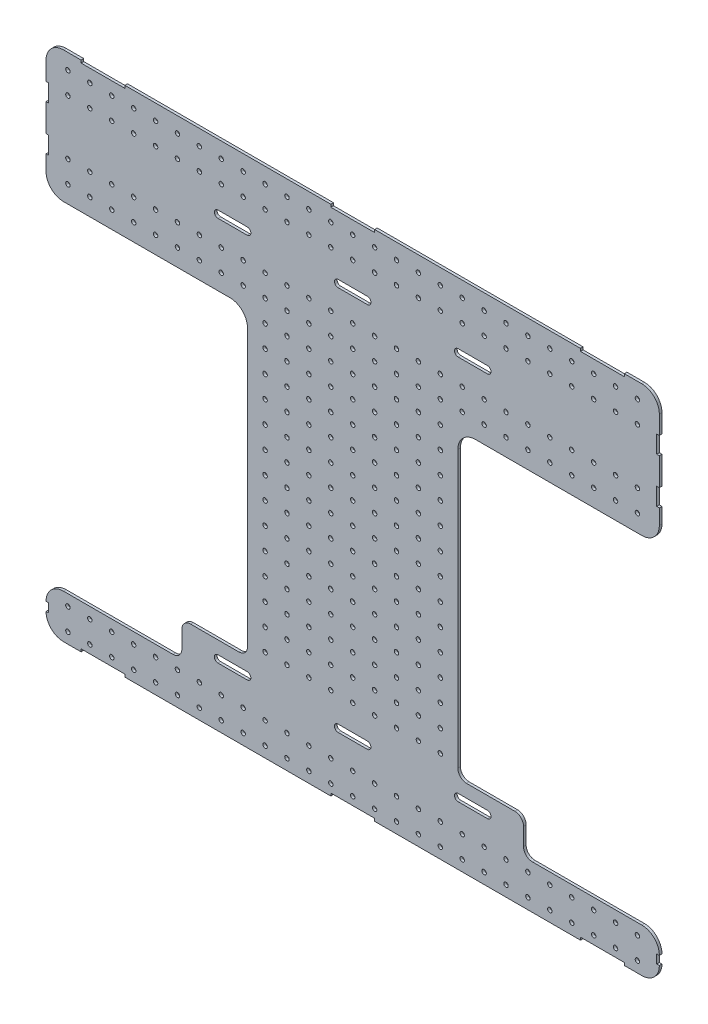
from build123d import *

# Parameters (mm, degrees)
SKETCH1_R           = 2
BOSS_EXTRUDE1_DEPTH = 3
CUT_EXTRUDE1_DEPTH  = 3
SKETCH3_W           = 50
SKETCH3_H           = 3
SKETCH3_W_2         = 3
SKETCH3_H_2         = 20
SKETCH3_H_3         = 10
CUT_EXTRUDE2_DEPTH  = 3
SKETCH4_W           = 235.846701978
SKETCH4_H           = 375.602037454
BOSS_EXTRUDE2_DEPTH = 3
SKETCH9_R           = 2.55
CUT_EXTRUDE7_DEPTH  = 3
SKETCH10_R          = 2.55
CUT_EXTRUDE8_DEPTH  = 3


with BuildPart() as part:
    # Sketch1 → Boss-Extrude1 (new body)
    with BuildSketch(Plane.XY):
        with BuildLine():
            Line((-330, 142.5), (-140, 142.5))
            ThreePointArc((-140, 142.5), (-125.857864376, 136.642135624), (-120, 122.5))
            Line((-120, 122.5), (-120, -192.5))
            ThreePointArc((-120, -192.5), (-122.928932188, -199.571067812), (-130, -202.5))
            Line((-130, -202.5), (-185, -202.5))
            ThreePointArc((-185, -202.5), (-192.071067812, -205.428932188), (-195, -212.5))
            Line((-195, -212.5), (-195, -232.5))
            ThreePointArc((-195, -232.5), (-197.928932188, -239.571067812), (-205, -242.5))
            Line((-205, -242.5), (-330, -242.5))
            ThreePointArc((-330, -242.5), (-344.142135624, -248.357864376), (-350, -262.5))
            Line((-350, -262.5), (-350, -272.5))
            ThreePointArc((-350, -272.5), (-344.142135624, -286.642135624), (-330, -292.5))
            Line((-330, -292.5), (330, -292.5))
            ThreePointArc((330, -292.5), (344.142135624, -286.642135624), (350, -272.5))
            Line((350, -272.5), (350, -262.5))
            ThreePointArc((350, -262.5), (344.142135624, -248.357864376), (330, -242.5))
            Line((330, -242.5), (205, -242.5))
            ThreePointArc((205, -242.5), (197.928932188, -239.571067812), (195, -232.5))
            Line((195, -232.5), (195, -212.5))
            ThreePointArc((195, -212.5), (192.071067812, -205.428932188), (185, -202.5))
            Line((185, -202.5), (130, -202.5))
            ThreePointArc((130, -202.5), (122.928932188, -199.571067812), (120, -192.5))
            Line((120, -192.5), (120, 122.5))
            ThreePointArc((120, 122.5), (125.857864376, 136.642135624), (140, 142.5))
            Line((140, 142.5), (330, 142.5))
            ThreePointArc((330, 142.5), (344.142135624, 148.357864376), (350, 162.5))
            Line((350, 162.5), (350, 272.5))
            ThreePointArc((350, 272.5), (344.142135624, 286.642135624), (330, 292.5))
            Line((330, 292.5), (-330, 292.5))
            ThreePointArc((-330, 292.5), (-344.142135624, 286.642135624), (-350, 272.5))
            Line((-350, 272.5), (-350, 162.5))
            ThreePointArc((-350, 162.5), (-344.142135624, 148.357864376), (-330, 142.5))
        make_face()
        with Locations((-65.041398582, 139.610304632)):
            Circle(SKETCH1_R, mode=Mode.SUBTRACT)
        with Locations((-35.041424734, 139.610304632)):
            Circle(SKETCH1_R, mode=Mode.SUBTRACT)
        with Locations((-5.041450886, 139.610304632)):
            Circle(SKETCH1_R, mode=Mode.SUBTRACT)
        with Locations((24.958522962, 139.610304632)):
            Circle(SKETCH1_R, mode=Mode.SUBTRACT)
        with Locations((54.95849681, 139.610304632)):
            Circle(SKETCH1_R, mode=Mode.SUBTRACT)
        with Locations((84.958470657, 139.610304632)):
            Circle(SKETCH1_R, mode=Mode.SUBTRACT)
        with Locations((114.958444505, 139.610304632)):
            Circle(SKETCH1_R, mode=Mode.SUBTRACT)
        with Locations((-95.082666402, 108.071843093)):
            Circle(SKETCH1_R, mode=Mode.SUBTRACT)
        with Locations((-65.082692554, 108.071843093)):
            Circle(SKETCH1_R, mode=Mode.SUBTRACT)
        with Locations((-35.082718706, 108.071843093)):
            Circle(SKETCH1_R, mode=Mode.SUBTRACT)
        with Locations((-5.082744859, 108.071843093)):
            Circle(SKETCH1_R, mode=Mode.SUBTRACT)
        with Locations((24.917228989, 108.071843093)):
            Circle(SKETCH1_R, mode=Mode.SUBTRACT)
        with Locations((54.917202837, 108.071843093)):
            Circle(SKETCH1_R, mode=Mode.SUBTRACT)
        with Locations((84.917176685, 108.071843093)):
            Circle(SKETCH1_R, mode=Mode.SUBTRACT)
        with Locations((114.917150533, 108.071843093)):
            Circle(SKETCH1_R, mode=Mode.SUBTRACT)
        with Locations((-65.123986527, 76.533381555)):
            Circle(SKETCH1_R, mode=Mode.SUBTRACT)
        with Locations((-35.124012679, 76.533381555)):
            Circle(SKETCH1_R, mode=Mode.SUBTRACT)
        with Locations((-5.124038831, 76.533381555)):
            Circle(SKETCH1_R, mode=Mode.SUBTRACT)
        with Locations((24.875935016, 76.533381555)):
            Circle(SKETCH1_R, mode=Mode.SUBTRACT)
        with Locations((54.875908864, 76.533381555)):
            Circle(SKETCH1_R, mode=Mode.SUBTRACT)
        with Locations((84.875882712, 76.533381555)):
            Circle(SKETCH1_R, mode=Mode.SUBTRACT)
        with Locations((114.87585656, 76.533381555)):
            Circle(SKETCH1_R, mode=Mode.SUBTRACT)
        with Locations((-95.165254347, 44.994920016)):
            Circle(SKETCH1_R, mode=Mode.SUBTRACT)
        with Locations((-65.1652805, 44.994920016)):
            Circle(SKETCH1_R, mode=Mode.SUBTRACT)
        with Locations((-35.165306652, 44.994920016)):
            Circle(SKETCH1_R, mode=Mode.SUBTRACT)
        with Locations((-5.165332804, 44.994920016)):
            Circle(SKETCH1_R, mode=Mode.SUBTRACT)
        with Locations((24.834641044, 44.994920016)):
            Circle(SKETCH1_R, mode=Mode.SUBTRACT)
        with Locations((54.834614891, 44.994920016)):
            Circle(SKETCH1_R, mode=Mode.SUBTRACT)
        with Locations((84.834588739, 44.994920016)):
            Circle(SKETCH1_R, mode=Mode.SUBTRACT)
        with Locations((114.834562587, 44.994920016)):
            Circle(SKETCH1_R, mode=Mode.SUBTRACT)
        with Locations((-95.20654832, 13.456458478)):
            Circle(SKETCH1_R, mode=Mode.SUBTRACT)
        with Locations((-65.206574472, 13.456458478)):
            Circle(SKETCH1_R, mode=Mode.SUBTRACT)
        with Locations((-35.206600625, 13.456458478)):
            Circle(SKETCH1_R, mode=Mode.SUBTRACT)
        with Locations((-5.206626777, 13.456458478)):
            Circle(SKETCH1_R, mode=Mode.SUBTRACT)
        with Locations((24.793347071, 13.456458478)):
            Circle(SKETCH1_R, mode=Mode.SUBTRACT)
        with Locations((54.793320919, 13.456458478)):
            Circle(SKETCH1_R, mode=Mode.SUBTRACT)
        with Locations((84.793294767, 13.456458478)):
            Circle(SKETCH1_R, mode=Mode.SUBTRACT)
        with Locations((114.793268614, 13.456458478)):
            Circle(SKETCH1_R, mode=Mode.SUBTRACT)
        with Locations((-95.247842293, -18.082003061)):
            Circle(SKETCH1_R, mode=Mode.SUBTRACT)
        with Locations((-65.247868445, -18.082003061)):
            Circle(SKETCH1_R, mode=Mode.SUBTRACT)
        with Locations((-35.247894597, -18.082003061)):
            Circle(SKETCH1_R, mode=Mode.SUBTRACT)
        with Locations((-5.24792075, -18.082003061)):
            Circle(SKETCH1_R, mode=Mode.SUBTRACT)
        with Locations((-25.977610299, 23.762148872)):
            Circle(SKETCH1_R, mode=Mode.SUBTRACT)
        with Locations((54.752026946, -18.082003061)):
            Circle(SKETCH1_R, mode=Mode.SUBTRACT)
        with Locations((84.752000794, -18.082003061)):
            Circle(SKETCH1_R, mode=Mode.SUBTRACT)
        with Locations((114.751974642, -18.082003061)):
            Circle(SKETCH1_R, mode=Mode.SUBTRACT)
        with Locations((-95.289136266, -49.620464599)):
            Circle(SKETCH1_R, mode=Mode.SUBTRACT)
        with Locations((-65.289162418, -49.620464599)):
            Circle(SKETCH1_R, mode=Mode.SUBTRACT)
        with Locations((-35.28918857, -49.620464599)):
            Circle(SKETCH1_R, mode=Mode.SUBTRACT)
        with Locations((-5.289214722, -49.620464599)):
            Circle(SKETCH1_R, mode=Mode.SUBTRACT)
        with Locations((24.710759126, -49.620464599)):
            Circle(SKETCH1_R, mode=Mode.SUBTRACT)
        with Locations((54.710732973, -49.620464599)):
            Circle(SKETCH1_R, mode=Mode.SUBTRACT)
        with Locations((84.710706821, -49.620464599)):
            Circle(SKETCH1_R, mode=Mode.SUBTRACT)
        with Locations((114.710680669, -49.620464599)):
            Circle(SKETCH1_R, mode=Mode.SUBTRACT)
        with Locations((-95.330430238, -81.158926138)):
            Circle(SKETCH1_R, mode=Mode.SUBTRACT)
        with Locations((-65.330456391, -81.158926138)):
            Circle(SKETCH1_R, mode=Mode.SUBTRACT)
        with Locations((-35.330482543, -81.158926138)):
            Circle(SKETCH1_R, mode=Mode.SUBTRACT)
        with Locations((-5.330508695, -81.158926138)):
            Circle(SKETCH1_R, mode=Mode.SUBTRACT)
        with Locations((24.669465153, -81.158926138)):
            Circle(SKETCH1_R, mode=Mode.SUBTRACT)
        with Locations((54.669439001, -81.158926138)):
            Circle(SKETCH1_R, mode=Mode.SUBTRACT)
        with Locations((84.669412848, -81.158926138)):
            Circle(SKETCH1_R, mode=Mode.SUBTRACT)
        with Locations((114.669386696, -81.158926138)):
            Circle(SKETCH1_R, mode=Mode.SUBTRACT)
        with Locations((-95.371724211, -112.697387676)):
            Circle(SKETCH1_R, mode=Mode.SUBTRACT)
        with Locations((-65.371750363, -112.697387676)):
            Circle(SKETCH1_R, mode=Mode.SUBTRACT)
        with Locations((-35.371776515, -112.697387676)):
            Circle(SKETCH1_R, mode=Mode.SUBTRACT)
        with Locations((-5.371802668, -112.697387676)):
            Circle(SKETCH1_R, mode=Mode.SUBTRACT)
        with Locations((24.62817118, -112.697387676)):
            Circle(SKETCH1_R, mode=Mode.SUBTRACT)
        with Locations((54.628145028, -112.697387676)):
            Circle(SKETCH1_R, mode=Mode.SUBTRACT)
        with Locations((84.628118876, -112.697387676)):
            Circle(SKETCH1_R, mode=Mode.SUBTRACT)
        with Locations((114.628092723, -112.697387676)):
            Circle(SKETCH1_R, mode=Mode.SUBTRACT)
        with Locations((-95.413018184, -144.235849214)):
            Circle(SKETCH1_R, mode=Mode.SUBTRACT)
        with Locations((-65.413044336, -144.235849214)):
            Circle(SKETCH1_R, mode=Mode.SUBTRACT)
        with Locations((-35.413070488, -144.235849214)):
            Circle(SKETCH1_R, mode=Mode.SUBTRACT)
        with Locations((-5.41309664, -144.235849214)):
            Circle(SKETCH1_R, mode=Mode.SUBTRACT)
        with Locations((24.586877207, -144.235849214)):
            Circle(SKETCH1_R, mode=Mode.SUBTRACT)
        with Locations((54.586851055, -144.235849214)):
            Circle(SKETCH1_R, mode=Mode.SUBTRACT)
        with Locations((84.586824903, -144.235849214)):
            Circle(SKETCH1_R, mode=Mode.SUBTRACT)
        with Locations((114.586798751, -144.235849214)):
            Circle(SKETCH1_R, mode=Mode.SUBTRACT)
        with Locations((-95.454312157, -175.774310753)):
            Circle(SKETCH1_R, mode=Mode.SUBTRACT)
        with Locations((-65.454338309, -175.774310753)):
            Circle(SKETCH1_R, mode=Mode.SUBTRACT)
        with Locations((-35.454364461, -175.774310753)):
            Circle(SKETCH1_R, mode=Mode.SUBTRACT)
        with Locations((-5.454390613, -175.774310753)):
            Circle(SKETCH1_R, mode=Mode.SUBTRACT)
        with Locations((24.545583235, -175.774310753)):
            Circle(SKETCH1_R, mode=Mode.SUBTRACT)
        with Locations((54.545557082, -175.774310753)):
            Circle(SKETCH1_R, mode=Mode.SUBTRACT)
        with Locations((84.54553093, -175.774310753)):
            Circle(SKETCH1_R, mode=Mode.SUBTRACT)
        with Locations((114.545504778, -175.774310753)):
            Circle(SKETCH1_R, mode=Mode.SUBTRACT)
    extrude(amount=BOSS_EXTRUDE1_DEPTH)

    # Sketch2 → Cut-Extrude1 (cut)
    with BuildSketch(Plane.XY.offset(3)):
        with BuildLine():
            Line((-153.761529372, 222.359633837), (-120.328695626, 222.359633837))
            ThreePointArc((-120.328695626, 222.359633837), (-116.228695626, 218.259633837), (-120.328695626, 214.159633837))
            Line((-120.328695626, 214.159633837), (-153.761529372, 214.159633837))
            ThreePointArc((-153.761529372, 214.159633837), (-157.861529372, 218.259633837), (-153.761529372, 222.359633837))
        make_face()
        with BuildLine():
            Line((153.761529372, 222.359633837), (120.328695626, 222.359633837))
            ThreePointArc((120.328695626, 222.359633837), (116.228695626, 218.259633837), (120.328695626, 214.159633837))
            Line((120.328695626, 214.159633837), (153.761529372, 214.159633837))
            ThreePointArc((153.761529372, 214.159633837), (157.861529372, 218.259633837), (153.761529372, 222.359633837))
        make_face()
        with BuildLine():
            Line((153.761529372, -217.237007727), (120.328695626, -217.237007727))
            ThreePointArc((120.328695626, -217.237007727), (116.228695626, -221.337007727), (120.328695626, -225.437007727))
            Line((120.328695626, -225.437007727), (153.761529372, -225.437007727))
            ThreePointArc((153.761529372, -225.437007727), (157.861529372, -221.337007727), (153.761529372, -217.237007727))
        make_face()
        with BuildLine():
            Line((-16.715, -225.437007727), (16.715, -225.437007727))
            ThreePointArc((16.715, -225.437007727), (20.815, -221.337007727), (16.715, -217.237007727))
            Line((16.715, -217.237007727), (-16.715, -217.237007727))
            ThreePointArc((-16.715, -217.237007727), (-20.815, -221.337007727), (-16.715, -225.437007727))
        make_face()
        with BuildLine():
            Line((-153.761529372, -225.437007727), (-120.328695626, -225.437007727))
            ThreePointArc((-120.328695626, -225.437007727), (-116.228695626, -221.337007727), (-120.328695626, -217.237007727))
            Line((-120.328695626, -217.237007727), (-153.761529372, -217.237007727))
            ThreePointArc((-153.761529372, -217.237007727), (-157.861529372, -221.337007727), (-153.761529372, -225.437007727))
        make_face()
        with BuildLine():
            Line((-16.715, 222.359633837), (16.715, 222.359633837))
            ThreePointArc((16.715, 222.359633837), (20.815, 218.259633837), (16.715, 214.159633837))
            Line((16.715, 214.159633837), (-16.715, 214.159633837))
            ThreePointArc((-16.715, 214.159633837), (-20.815, 218.259633837), (-16.715, 222.359633837))
        make_face()
    extrude(amount=-CUT_EXTRUDE1_DEPTH, mode=Mode.SUBTRACT)

    # Sketch3 → Cut-Extrude2 (cut)
    with BuildSketch(Plane.XY.offset(3)):
        with Locations((-285, 291)):
            Rectangle(SKETCH3_W, SKETCH3_H)
        with Locations((0, 291)):
            Rectangle(SKETCH3_W, SKETCH3_H)
        with Locations((285, 291)):
            Rectangle(SKETCH3_W, SKETCH3_H)
        with Locations((-348.5, 241.362705002)):
            Rectangle(SKETCH3_W_2, SKETCH3_H_2)
        with Locations((348.5, 241.362705002)):
            Rectangle(SKETCH3_W_2, SKETCH3_H_2)
        with Locations((285, -291)):
            Rectangle(SKETCH3_W, SKETCH3_H)
        with Locations((0, -291)):
            Rectangle(SKETCH3_W, SKETCH3_H)
        with Locations((-285, -291)):
            Rectangle(SKETCH3_W, SKETCH3_H)
        with Locations((348.5, 189.79436506)):
            Rectangle(SKETCH3_W_2, SKETCH3_H_2)
        with Locations((-348.5, -267.5)):
            Rectangle(SKETCH3_W_2, SKETCH3_H_3)
        with Locations((348.5, -267.5)):
            Rectangle(SKETCH3_W_2, SKETCH3_H_3)
        with Locations((-348.5, 189.79436506)):
            Rectangle(SKETCH3_W_2, SKETCH3_H_2)
    extrude(amount=-CUT_EXTRUDE2_DEPTH, mode=Mode.SUBTRACT)

    # Sketch4 → Boss-Extrude2 (add)
    with BuildSketch(Plane.XY.offset(3)):
        Rectangle(SKETCH4_W, SKETCH4_H)
    extrude(amount=-BOSS_EXTRUDE2_DEPTH)

    # Sketch9 → Cut-Extrude7 (cut)
    with BuildSketch(Plane.XY.offset(3)):
        with Locations((-325, 187.159633837)):
            Circle(SKETCH9_R)
        with Locations((-300, 187.159633837)):
            Circle(SKETCH9_R)
        with Locations((-275, 187.159633837)):
            Circle(SKETCH9_R)
        with Locations((-250, 187.159633837)):
            Circle(SKETCH9_R)
        with Locations((-225, 187.159633837)):
            Circle(SKETCH9_R)
        with Locations((-200, 187.159633837)):
            Circle(SKETCH9_R)
        with Locations((-175, 187.159633837)):
            Circle(SKETCH9_R)
        with Locations((-150, 187.159633837)):
            Circle(SKETCH9_R)
        with Locations((-125, 187.159633837)):
            Circle(SKETCH9_R)
        with Locations((-100, 187.159633837)):
            Circle(SKETCH9_R)
        with Locations((-75, 187.159633837)):
            Circle(SKETCH9_R)
        with Locations((-50, 187.159633837)):
            Circle(SKETCH9_R)
        with Locations((-25, 187.159633837)):
            Circle(SKETCH9_R)
        with Locations((0, 187.159633837)):
            Circle(SKETCH9_R)
        with Locations((25, 187.159633837)):
            Circle(SKETCH9_R)
        with Locations((50, 187.159633837)):
            Circle(SKETCH9_R)
        with Locations((75, 187.159633837)):
            Circle(SKETCH9_R)
        with Locations((100, 187.159633837)):
            Circle(SKETCH9_R)
        with Locations((125, 187.159633837)):
            Circle(SKETCH9_R)
        with Locations((150, 187.159633837)):
            Circle(SKETCH9_R)
        with Locations((175, 187.159633837)):
            Circle(SKETCH9_R)
        with Locations((-300, 162.159633837)):
            Circle(SKETCH9_R)
        with Locations((-275, 162.159633837)):
            Circle(SKETCH9_R)
        with Locations((-250, 162.159633837)):
            Circle(SKETCH9_R)
        with Locations((-225, 162.159633837)):
            Circle(SKETCH9_R)
        with Locations((-200, 162.159633837)):
            Circle(SKETCH9_R)
        with Locations((-175, 162.159633837)):
            Circle(SKETCH9_R)
        with Locations((-150, 162.159633837)):
            Circle(SKETCH9_R)
        with Locations((-125, 162.159633837)):
            Circle(SKETCH9_R)
        with Locations((-100, 162.159633837)):
            Circle(SKETCH9_R)
        with Locations((-75, 162.159633837)):
            Circle(SKETCH9_R)
        with Locations((-50, 162.159633837)):
            Circle(SKETCH9_R)
        with Locations((-25, 162.159633837)):
            Circle(SKETCH9_R)
        with Locations((0, 162.159633837)):
            Circle(SKETCH9_R)
        with Locations((25, 162.159633837)):
            Circle(SKETCH9_R)
        with Locations((50, 162.159633837)):
            Circle(SKETCH9_R)
        with Locations((75, 162.159633837)):
            Circle(SKETCH9_R)
        with Locations((100, 162.159633837)):
            Circle(SKETCH9_R)
        with Locations((125, 162.159633837)):
            Circle(SKETCH9_R)
        with Locations((150, 162.159633837)):
            Circle(SKETCH9_R)
        with Locations((175, 162.159633837)):
            Circle(SKETCH9_R)
        with Locations((-325, 162.159633837)):
            Circle(SKETCH9_R)
        with Locations((-100, 137.159633837)):
            Circle(SKETCH9_R)
        with Locations((-75, 137.159633837)):
            Circle(SKETCH9_R)
        with Locations((-50, 137.159633837)):
            Circle(SKETCH9_R)
        with Locations((-25, 137.159633837)):
            Circle(SKETCH9_R)
        with Locations((0, 137.159633837)):
            Circle(SKETCH9_R)
        with Locations((25, 137.159633837)):
            Circle(SKETCH9_R)
        with Locations((-100, 112.159633837)):
            Circle(SKETCH9_R)
        with Locations((-75, 112.159633837)):
            Circle(SKETCH9_R)
        with Locations((-50, 112.159633837)):
            Circle(SKETCH9_R)
        with Locations((-25, 112.159633837)):
            Circle(SKETCH9_R)
        with Locations((0, 112.159633837)):
            Circle(SKETCH9_R)
        with Locations((25, 112.159633837)):
            Circle(SKETCH9_R)
        with Locations((-100, 87.159633837)):
            Circle(SKETCH9_R)
        with Locations((-75, 87.159633837)):
            Circle(SKETCH9_R)
        with Locations((-50, 87.159633837)):
            Circle(SKETCH9_R)
        with Locations((-25, 87.159633837)):
            Circle(SKETCH9_R)
        with Locations((0, 87.159633837)):
            Circle(SKETCH9_R)
        with Locations((25, 87.159633837)):
            Circle(SKETCH9_R)
        with Locations((-100, 62.159633837)):
            Circle(SKETCH9_R)
        with Locations((-75, 62.159633837)):
            Circle(SKETCH9_R)
        with Locations((-50, 62.159633837)):
            Circle(SKETCH9_R)
        with Locations((-25, 62.159633837)):
            Circle(SKETCH9_R)
        with Locations((0, 62.159633837)):
            Circle(SKETCH9_R)
        with Locations((25, 62.159633837)):
            Circle(SKETCH9_R)
        with Locations((-100, 37.159633837)):
            Circle(SKETCH9_R)
        with Locations((-75, 37.159633837)):
            Circle(SKETCH9_R)
        with Locations((-50, 37.159633837)):
            Circle(SKETCH9_R)
        with Locations((-25, 37.159633837)):
            Circle(SKETCH9_R)
        with Locations((0, 37.159633837)):
            Circle(SKETCH9_R)
        with Locations((25, 37.159633837)):
            Circle(SKETCH9_R)
        with Locations((-100, 12.159633837)):
            Circle(SKETCH9_R)
        with Locations((-75, 12.159633837)):
            Circle(SKETCH9_R)
        with Locations((-50, 12.159633837)):
            Circle(SKETCH9_R)
        with Locations((-25, 12.159633837)):
            Circle(SKETCH9_R)
        with Locations((0, 12.159633837)):
            Circle(SKETCH9_R)
        with Locations((25, 12.159633837)):
            Circle(SKETCH9_R)
        with Locations((-100, -12.840366163)):
            Circle(SKETCH9_R)
        with Locations((-75, -12.840366163)):
            Circle(SKETCH9_R)
        with Locations((-50, -12.840366163)):
            Circle(SKETCH9_R)
        with Locations((-25, -12.840366163)):
            Circle(SKETCH9_R)
        with Locations((0, -12.840366163)):
            Circle(SKETCH9_R)
        with Locations((25, -12.840366163)):
            Circle(SKETCH9_R)
        with Locations((-100, -37.840366163)):
            Circle(SKETCH9_R)
        with Locations((-75, -37.840366163)):
            Circle(SKETCH9_R)
        with Locations((-50, -37.840366163)):
            Circle(SKETCH9_R)
        with Locations((-25, -37.840366163)):
            Circle(SKETCH9_R)
        with Locations((0, -37.840366163)):
            Circle(SKETCH9_R)
        with Locations((25, -37.840366163)):
            Circle(SKETCH9_R)
        with Locations((-100, -62.840366163)):
            Circle(SKETCH9_R)
        with Locations((-75, -62.840366163)):
            Circle(SKETCH9_R)
        with Locations((-50, -62.840366163)):
            Circle(SKETCH9_R)
        with Locations((-25, -62.840366163)):
            Circle(SKETCH9_R)
        with Locations((0, -62.840366163)):
            Circle(SKETCH9_R)
        with Locations((25, -62.840366163)):
            Circle(SKETCH9_R)
        with Locations((-100, -87.840366163)):
            Circle(SKETCH9_R)
        with Locations((-75, -87.840366163)):
            Circle(SKETCH9_R)
        with Locations((-50, -87.840366163)):
            Circle(SKETCH9_R)
        with Locations((-25, -87.840366163)):
            Circle(SKETCH9_R)
        with Locations((0, -87.840366163)):
            Circle(SKETCH9_R)
        with Locations((25, -87.840366163)):
            Circle(SKETCH9_R)
        with Locations((-100, -112.840366163)):
            Circle(SKETCH9_R)
        with Locations((-75, -112.840366163)):
            Circle(SKETCH9_R)
        with Locations((-50, -112.840366163)):
            Circle(SKETCH9_R)
        with Locations((-25, -112.840366163)):
            Circle(SKETCH9_R)
        with Locations((0, -112.840366163)):
            Circle(SKETCH9_R)
        with Locations((25, -112.840366163)):
            Circle(SKETCH9_R)
        with Locations((-100, -137.840366163)):
            Circle(SKETCH9_R)
        with Locations((-75, -137.840366163)):
            Circle(SKETCH9_R)
        with Locations((-50, -137.840366163)):
            Circle(SKETCH9_R)
        with Locations((-25, -137.840366163)):
            Circle(SKETCH9_R)
        with Locations((0, -137.840366163)):
            Circle(SKETCH9_R)
        with Locations((25, -137.840366163)):
            Circle(SKETCH9_R)
        with Locations((-100, -162.840366163)):
            Circle(SKETCH9_R)
        with Locations((-75, -162.840366163)):
            Circle(SKETCH9_R)
        with Locations((-50, -162.840366163)):
            Circle(SKETCH9_R)
        with Locations((-25, -162.840366163)):
            Circle(SKETCH9_R)
        with Locations((0, -162.840366163)):
            Circle(SKETCH9_R)
        with Locations((25, -162.840366163)):
            Circle(SKETCH9_R)
        with Locations((-100, -187.840366163)):
            Circle(SKETCH9_R)
        with Locations((-75, -187.840366163)):
            Circle(SKETCH9_R)
        with Locations((-50, -187.840366163)):
            Circle(SKETCH9_R)
        with Locations((-25, -187.840366163)):
            Circle(SKETCH9_R)
        with Locations((0, -187.840366163)):
            Circle(SKETCH9_R)
        with Locations((25, -187.840366163)):
            Circle(SKETCH9_R)
        with Locations((200, 187.159633837)):
            Circle(SKETCH9_R)
        with Locations((200, 162.159633837)):
            Circle(SKETCH9_R)
        with Locations((225, 187.159633837)):
            Circle(SKETCH9_R)
        with Locations((225, 162.159633837)):
            Circle(SKETCH9_R)
        with Locations((250, 187.159633837)):
            Circle(SKETCH9_R)
        with Locations((250, 162.159633837)):
            Circle(SKETCH9_R)
        with Locations((275, 187.159633837)):
            Circle(SKETCH9_R)
        with Locations((275, 162.159633837)):
            Circle(SKETCH9_R)
        with Locations((300, 187.159633837)):
            Circle(SKETCH9_R)
        with Locations((300, 162.159633837)):
            Circle(SKETCH9_R)
        with Locations((325, 187.159633837)):
            Circle(SKETCH9_R)
        with Locations((325, 162.159633837)):
            Circle(SKETCH9_R)
        with Locations((50, 137.159633837)):
            Circle(SKETCH9_R)
        with Locations((75, 137.159633837)):
            Circle(SKETCH9_R)
        with Locations((100, 137.159633837)):
            Circle(SKETCH9_R)
        with Locations((50, 112.159633837)):
            Circle(SKETCH9_R)
        with Locations((75, 112.159633837)):
            Circle(SKETCH9_R)
        with Locations((100, 112.159633837)):
            Circle(SKETCH9_R)
        with Locations((50, 87.159633837)):
            Circle(SKETCH9_R)
        with Locations((75, 87.159633837)):
            Circle(SKETCH9_R)
        with Locations((100, 87.159633837)):
            Circle(SKETCH9_R)
        with Locations((50, 62.159633837)):
            Circle(SKETCH9_R)
        with Locations((75, 62.159633837)):
            Circle(SKETCH9_R)
        with Locations((100, 62.159633837)):
            Circle(SKETCH9_R)
        with Locations((50, 37.159633837)):
            Circle(SKETCH9_R)
        with Locations((75, 37.159633837)):
            Circle(SKETCH9_R)
        with Locations((100, 37.159633837)):
            Circle(SKETCH9_R)
        with Locations((50, 12.159633837)):
            Circle(SKETCH9_R)
        with Locations((75, 12.159633837)):
            Circle(SKETCH9_R)
        with Locations((100, 12.159633837)):
            Circle(SKETCH9_R)
        with Locations((50, -12.840366163)):
            Circle(SKETCH9_R)
        with Locations((75, -12.840366163)):
            Circle(SKETCH9_R)
        with Locations((100, -12.840366163)):
            Circle(SKETCH9_R)
        with Locations((50, -37.840366163)):
            Circle(SKETCH9_R)
        with Locations((75, -37.840366163)):
            Circle(SKETCH9_R)
        with Locations((100, -37.840366163)):
            Circle(SKETCH9_R)
        with Locations((50, -62.840366163)):
            Circle(SKETCH9_R)
        with Locations((75, -62.840366163)):
            Circle(SKETCH9_R)
        with Locations((100, -62.840366163)):
            Circle(SKETCH9_R)
        with Locations((50, -87.840366163)):
            Circle(SKETCH9_R)
        with Locations((75, -87.840366163)):
            Circle(SKETCH9_R)
        with Locations((100, -87.840366163)):
            Circle(SKETCH9_R)
        with Locations((50, -112.840366163)):
            Circle(SKETCH9_R)
        with Locations((75, -112.840366163)):
            Circle(SKETCH9_R)
        with Locations((100, -112.840366163)):
            Circle(SKETCH9_R)
        with Locations((50, -137.840366163)):
            Circle(SKETCH9_R)
        with Locations((75, -137.840366163)):
            Circle(SKETCH9_R)
        with Locations((100, -137.840366163)):
            Circle(SKETCH9_R)
        with Locations((50, -162.840366163)):
            Circle(SKETCH9_R)
        with Locations((75, -162.840366163)):
            Circle(SKETCH9_R)
        with Locations((100, -162.840366163)):
            Circle(SKETCH9_R)
        with Locations((50, -187.840366163)):
            Circle(SKETCH9_R)
        with Locations((75, -187.840366163)):
            Circle(SKETCH9_R)
        with Locations((100, -187.840366163)):
            Circle(SKETCH9_R)
    extrude(amount=-CUT_EXTRUDE7_DEPTH, mode=Mode.SUBTRACT)

    # Sketch10 → Cut-Extrude8 (cut)
    with BuildSketch(Plane.XY.offset(3)):
        with Locations((-325, -255.152650826)):
            Circle(SKETCH10_R)
        with Locations((-300, -255.152650826)):
            Circle(SKETCH10_R)
        with Locations((-275, -255.152650826)):
            Circle(SKETCH10_R)
        with Locations((-250, -255.152650826)):
            Circle(SKETCH10_R)
        with Locations((-225, -255.152650826)):
            Circle(SKETCH10_R)
        with Locations((-200, -255.152650826)):
            Circle(SKETCH10_R)
        with Locations((-175, -255.152650826)):
            Circle(SKETCH10_R)
        with Locations((-150, -255.152650826)):
            Circle(SKETCH10_R)
        with Locations((-125, -255.152650826)):
            Circle(SKETCH10_R)
        with Locations((-100, -255.152650826)):
            Circle(SKETCH10_R)
        with Locations((-75, -255.152650826)):
            Circle(SKETCH10_R)
        with Locations((-50, -255.152650826)):
            Circle(SKETCH10_R)
        with Locations((-25, -255.152650826)):
            Circle(SKETCH10_R)
        with Locations((0, -255.152650826)):
            Circle(SKETCH10_R)
        with Locations((25, -255.152650826)):
            Circle(SKETCH10_R)
        with Locations((50, -255.152650826)):
            Circle(SKETCH10_R)
        with Locations((75, -255.152650826)):
            Circle(SKETCH10_R)
        with Locations((100, -255.152650826)):
            Circle(SKETCH10_R)
        with Locations((125, -255.152650826)):
            Circle(SKETCH10_R)
        with Locations((150, -255.152650826)):
            Circle(SKETCH10_R)
        with Locations((175, -255.152650826)):
            Circle(SKETCH10_R)
        with Locations((-300, -280.152650826)):
            Circle(SKETCH10_R)
        with Locations((-275, -280.152650826)):
            Circle(SKETCH10_R)
        with Locations((-250, -280.152650826)):
            Circle(SKETCH10_R)
        with Locations((-225, -280.152650826)):
            Circle(SKETCH10_R)
        with Locations((-200, -280.152650826)):
            Circle(SKETCH10_R)
        with Locations((-175, -280.152650826)):
            Circle(SKETCH10_R)
        with Locations((-150, -280.152650826)):
            Circle(SKETCH10_R)
        with Locations((-125, -280.152650826)):
            Circle(SKETCH10_R)
        with Locations((-100, -280.152650826)):
            Circle(SKETCH10_R)
        with Locations((-75, -280.152650826)):
            Circle(SKETCH10_R)
        with Locations((-50, -280.152650826)):
            Circle(SKETCH10_R)
        with Locations((-25, -280.152650826)):
            Circle(SKETCH10_R)
        with Locations((0, -280.152650826)):
            Circle(SKETCH10_R)
        with Locations((25, -280.152650826)):
            Circle(SKETCH10_R)
        with Locations((50, -280.152650826)):
            Circle(SKETCH10_R)
        with Locations((75, -280.152650826)):
            Circle(SKETCH10_R)
        with Locations((100, -280.152650826)):
            Circle(SKETCH10_R)
        with Locations((125, -280.152650826)):
            Circle(SKETCH10_R)
        with Locations((150, -280.152650826)):
            Circle(SKETCH10_R)
        with Locations((175, -280.152650826)):
            Circle(SKETCH10_R)
        with Locations((-325, -280.152650826)):
            Circle(SKETCH10_R)
        with Locations((-325, 274.86)):
            Circle(SKETCH10_R)
        with Locations((-300, 274.86)):
            Circle(SKETCH10_R)
        with Locations((-275, 274.86)):
            Circle(SKETCH10_R)
        with Locations((-250, 274.86)):
            Circle(SKETCH10_R)
        with Locations((-225, 274.86)):
            Circle(SKETCH10_R)
        with Locations((-200, 274.86)):
            Circle(SKETCH10_R)
        with Locations((-175, 274.86)):
            Circle(SKETCH10_R)
        with Locations((-150, 274.86)):
            Circle(SKETCH10_R)
        with Locations((-125, 274.86)):
            Circle(SKETCH10_R)
        with Locations((-100, 274.86)):
            Circle(SKETCH10_R)
        with Locations((-75, 274.86)):
            Circle(SKETCH10_R)
        with Locations((-50, 274.86)):
            Circle(SKETCH10_R)
        with Locations((-25, 274.86)):
            Circle(SKETCH10_R)
        with Locations((0, 274.86)):
            Circle(SKETCH10_R)
        with Locations((25, 274.86)):
            Circle(SKETCH10_R)
        with Locations((50, 274.86)):
            Circle(SKETCH10_R)
        with Locations((75, 274.86)):
            Circle(SKETCH10_R)
        with Locations((100, 274.86)):
            Circle(SKETCH10_R)
        with Locations((125, 274.86)):
            Circle(SKETCH10_R)
        with Locations((150, 274.86)):
            Circle(SKETCH10_R)
        with Locations((175, 274.86)):
            Circle(SKETCH10_R)
        with Locations((-300, 249.86)):
            Circle(SKETCH10_R)
        with Locations((-275, 249.86)):
            Circle(SKETCH10_R)
        with Locations((-250, 249.86)):
            Circle(SKETCH10_R)
        with Locations((-225, 249.86)):
            Circle(SKETCH10_R)
        with Locations((-200, 249.86)):
            Circle(SKETCH10_R)
        with Locations((-175, 249.86)):
            Circle(SKETCH10_R)
        with Locations((-150, 249.86)):
            Circle(SKETCH10_R)
        with Locations((-125, 249.86)):
            Circle(SKETCH10_R)
        with Locations((-100, 249.86)):
            Circle(SKETCH10_R)
        with Locations((-75, 249.86)):
            Circle(SKETCH10_R)
        with Locations((-50, 249.86)):
            Circle(SKETCH10_R)
        with Locations((-25, 249.86)):
            Circle(SKETCH10_R)
        with Locations((0, 249.86)):
            Circle(SKETCH10_R)
        with Locations((25, 249.86)):
            Circle(SKETCH10_R)
        with Locations((50, 249.86)):
            Circle(SKETCH10_R)
        with Locations((75, 249.86)):
            Circle(SKETCH10_R)
        with Locations((100, 249.86)):
            Circle(SKETCH10_R)
        with Locations((125, 249.86)):
            Circle(SKETCH10_R)
        with Locations((150, 249.86)):
            Circle(SKETCH10_R)
        with Locations((175, 249.86)):
            Circle(SKETCH10_R)
        with Locations((-325, 249.86)):
            Circle(SKETCH10_R)
        with Locations((200, 274.86)):
            Circle(SKETCH10_R)
        with Locations((225, 274.86)):
            Circle(SKETCH10_R)
        with Locations((250, 274.86)):
            Circle(SKETCH10_R)
        with Locations((275, 274.86)):
            Circle(SKETCH10_R)
        with Locations((300, 274.86)):
            Circle(SKETCH10_R)
        with Locations((325, 274.86)):
            Circle(SKETCH10_R)
        with Locations((200, 249.86)):
            Circle(SKETCH10_R)
        with Locations((225, 249.86)):
            Circle(SKETCH10_R)
        with Locations((250, 249.86)):
            Circle(SKETCH10_R)
        with Locations((275, 249.86)):
            Circle(SKETCH10_R)
        with Locations((300, 249.86)):
            Circle(SKETCH10_R)
        with Locations((325, 249.86)):
            Circle(SKETCH10_R)
        with Locations((200, -255.152650826)):
            Circle(SKETCH10_R)
        with Locations((225, -255.152650826)):
            Circle(SKETCH10_R)
        with Locations((250, -255.152650826)):
            Circle(SKETCH10_R)
        with Locations((275, -255.152650826)):
            Circle(SKETCH10_R)
        with Locations((300, -255.152650826)):
            Circle(SKETCH10_R)
        with Locations((325, -255.152650826)):
            Circle(SKETCH10_R)
        with Locations((200, -280.152650826)):
            Circle(SKETCH10_R)
        with Locations((225, -280.152650826)):
            Circle(SKETCH10_R)
        with Locations((250, -280.152650826)):
            Circle(SKETCH10_R)
        with Locations((275, -280.152650826)):
            Circle(SKETCH10_R)
        with Locations((300, -280.152650826)):
            Circle(SKETCH10_R)
        with Locations((325, -280.152650826)):
            Circle(SKETCH10_R)
    extrude(amount=-CUT_EXTRUDE8_DEPTH, mode=Mode.SUBTRACT)


solid = part.part
